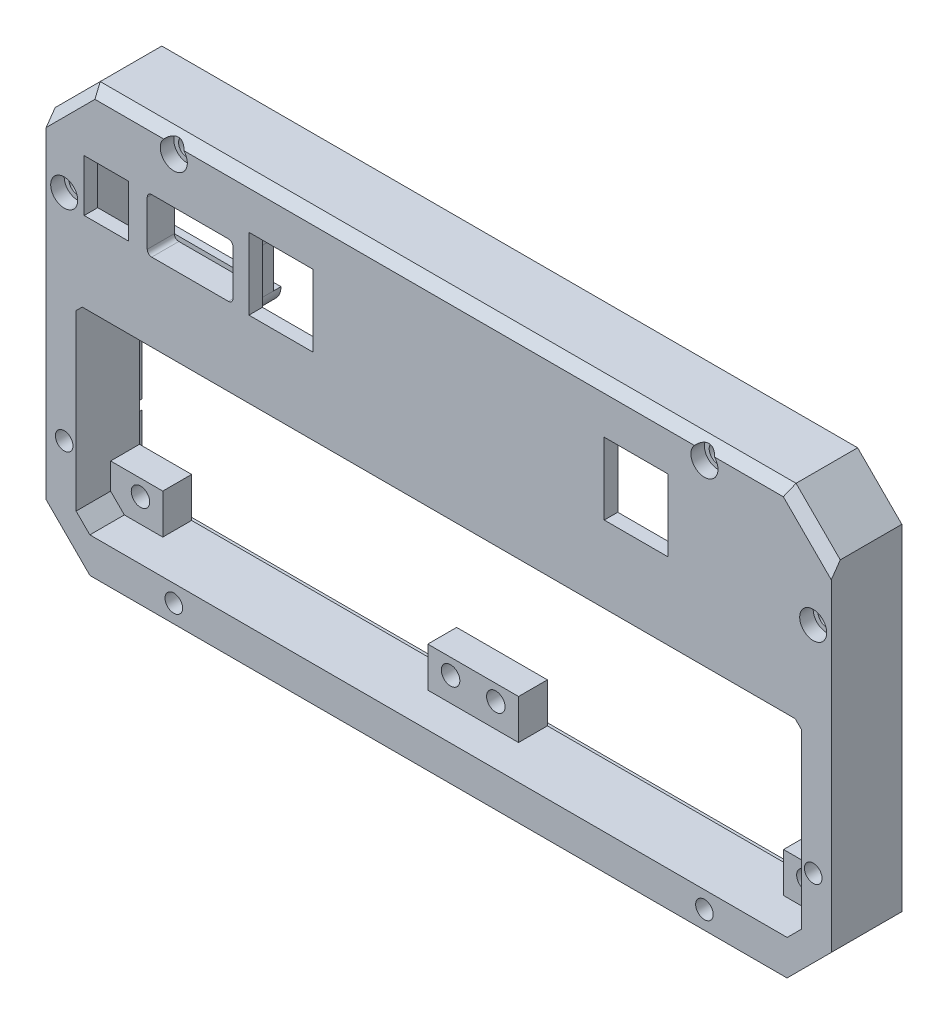
from build123d import *

# Parameters (mm, degrees)
EXTRUDE_1_DEPTH     = 15.65
SKETCH_4_W          = 9.8
SKETCH_4_H          = 11.5
SKETCH_4_W_2        = 12.96
SKETCH_4_H_2        = 14.97
EXTRUDE_4_DEPTH     = 3
SKETCH_5_R          = 1.95
CUT_EXTRUDE_1_DEPTH = 173.299210828
SKETCH_6_R          = 3
CUT_EXTRUDE_2_DEPTH = 3
SKETCH_9_W          = 10
SKETCH_9_H          = 8.842122099
SKETCH_9_R          = 2.05
SKETCH_9_H_2        = 11.008838114
EXTRUDE_5_DEPTH     = 6.4
CUT_EXTRUDE_3_DEPTH = 3
EXTRUDE_6_DEPTH     = 3
EXTRUDE_7_DEPTH     = 1.65
CHAMFER_2_SIZE      = 2
CUT_EXTRUDE_4_DEPTH = 1.6
SKETCH_14_W         = 158.083526154
SKETCH_14_H         = 7.071067811
EXTRUDE_8_DEPTH     = 3
CUT_EXTRUDE_5_DEPTH = 7
EXTRUDE_START       = 4.65
SKETCH_16_W         = 10
SKETCH_16_H         = 11.008838114
SKETCH_16_H_2       = 8.842122099
EXTRUDE_9_DEPTH     = 4.65
SKETCH_18_W         = 12.96
SKETCH_18_H         = 14.97
EXTRUDE_10_DEPTH    = 3
SKETCH_19_W         = 14.168486711
SKETCH_19_H         = 15.912581757
SKETCH_19_W_2       = 12.168486711
SKETCH_19_H_2       = 13.912581757
SKETCH_19_H_3       = 15.912581758
SKETCH_19_H_4       = 13.912581758
CUT_EXTRUDE_6_DEPTH = 173.052660694


with BuildPart() as part:
    # 草图1 → 凸台-拉伸1 (new body)
    with BuildSketch(Plane.XY):
        Polygon((-134.597401901, 96.434595611), (-134.597401901, 22.128293189), (-124.890175211, 12.421066499), (29.682675464, 12.421066499), (39.486124253, 22.224515288), (39.486124253, 96.618517711), (29.682675464, 106.421966499), (-124.610031013, 106.421966499), align=None)
        Polygon((-125.038101901, 94.680187113), (-121.296322514, 98.421966499), (26.368966965, 98.421966499), (29.452624253, 95.338309212), (31.486124253, 93.304809212), (31.486124253, 63.120887113), (32.844361176, 61.762650189), (32.844361176, 23.360926804), (29.704500871, 20.221066499), (-124.912000618, 20.221066499), (-127.955638824, 23.264704705), (-127.955638824, 61.762650189), (-126.597401901, 63.120887113), (-126.597401901, 93.120887113), align=None, mode=Mode.SUBTRACT)
    extrude(amount=EXTRUDE_1_DEPTH)

    # 草图5 → 切除-拉伸1 (cut, through all)
    with BuildSketch(Plane.XY.offset(15.65)):
        with Locations((-106.296322514, 102.421966499)):
            Circle(SKETCH_5_R)
        with Locations((11.368966965, 102.421966499)):
            Circle(SKETCH_5_R)
        with Locations((35.486124253, 83.120887113)):
            Circle(SKETCH_5_R)
        with Locations((35.486124253, 35.442001688)):
            Circle(SKETCH_5_R)
        with Locations((11.368966965, 16.421066499)):
            Circle(SKETCH_5_R)
        with Locations((-106.296322514, 16.421066499)):
            Circle(SKETCH_5_R)
        with Locations((-130.597401901, 35.442001688)):
            Circle(SKETCH_5_R)
        with Locations((-130.597401901, 83.120887113)):
            Circle(SKETCH_5_R)
    extrude(amount=-CUT_EXTRUDE_1_DEPTH, mode=Mode.SUBTRACT)

    # 草图6 → 切除-拉伸2 (cut)
    with BuildSketch(Plane.XY.offset(15.65)):
        with Locations((-130.597401901, 83.120887113)):
            Circle(SKETCH_6_R)
        with Locations((-106.296322514, 102.421966499)):
            Circle(SKETCH_6_R)
        with Locations((11.368966965, 102.421966499)):
            Circle(SKETCH_6_R)
        with Locations((35.486124253, 83.120887113)):
            Circle(SKETCH_6_R)
    extrude(amount=-CUT_EXTRUDE_2_DEPTH, mode=Mode.SUBTRACT)

    # 草图9 → 凸台-拉伸5 (add)
    # profile 1 of 7: a face of its own
    with BuildSketch(Plane.XY.offset(1.6)):
        with Locations((-109.379401901, 94.00090545)):
            Rectangle(SKETCH_9_W, SKETCH_9_H)
        with Locations(Location((-109.277479202, 93.020847168, 0), (0, 0, 180))):
            Circle(SKETCH_9_R, mode=Mode.SUBTRACT)
    # profile 2 of 7: a face of its own
    with BuildSketch(Plane.XY.offset(1.6)):
        Polygon((-47.635101901, 29.063188599), (-47.502375747, 29.063188599), (-37.502375747, 29.063188599), (-37.502375747, 20.221066499), (-47.635101901, 20.221066499), (-57.635101901, 20.221066499), (-57.635101901, 29.063188599), align=None)
        with Locations(Location((-52.57429681, 25.579954761, 0), (0, 0, 180))):
            Circle(SKETCH_9_R, mode=Mode.SUBTRACT)
        with Locations(Location((-42.540505261, 25.563037191, 0), (0, 0, 180))):
            Circle(SKETCH_9_R, mode=Mode.SUBTRACT)
    # profile 3 of 7: a face of its own
    with BuildSketch(Plane.XY.offset(1.6)):
        with Locations((-30.488175747, 94.00090545)):
            Rectangle(SKETCH_9_W, SKETCH_9_H)
        with Locations(Location((-30.485135247, 93.068897898, 0), (0, 0, 180))):
            Circle(SKETCH_9_R, mode=Mode.SUBTRACT)
    # profile 4 of 7: a face of its own
    with BuildSketch(Plane.XY.offset(1.6)):
        Polygon((-126.393601901, 29.063188599), (-116.393601901, 29.063188599), (-116.393601901, 20.221066499), (-124.912000618, 20.221066499), (-127.955638824, 23.264704705), (-127.955638824, 29.063188599), align=None)
        with Locations(Location((-121.332849216, 25.514986462, 0), (0, 0, 180))):
            Circle(SKETCH_9_R, mode=Mode.SUBTRACT)
    # profile 5 of 7: a face of its own
    with BuildSketch(Plane.XY.offset(1.6)):
        Polygon((21.256124253, 20.221066499), (21.256124253, 29.063188599), (31.256124253, 29.063188599), (32.844361176, 29.063188599), (32.844361176, 23.360926804), (29.704500871, 20.221066499), align=None)
        with Locations(Location((26.218047145, 25.62800549, 0), (0, 0, 180))):
            Circle(SKETCH_9_R, mode=Mode.SUBTRACT)
    # profile 6 of 7: a face of its own
    with BuildSketch(Plane.XY.offset(1.6)):
        with Locations((19.452353698, 92.917547442)):
            Rectangle(SKETCH_9_W, SKETCH_9_H_2)
        with Locations(Location((19.374110595, 91.489091443, 0), (0, 0, 180))):
            Circle(SKETCH_9_R, mode=Mode.SUBTRACT)
    # profile 7 of 7: a face of its own
    with BuildSketch(Plane.XY.offset(1.6)):
        with Locations((-59.438793215, 92.917547442)):
            Rectangle(SKETCH_9_W, SKETCH_9_H_2)
        with Locations(Location((-59.41823336, 91.441040714, 0), (0, 0, 180))):
            Circle(SKETCH_9_R, mode=Mode.SUBTRACT)
    extrude(amount=EXTRUDE_5_DEPTH)



with BuildPart() as body_2:
    # 草图4 → 凸台-拉伸4 (new body)
    with BuildSketch(Plane.XY.offset(15.65)):
        Polygon((-126.597401901, 70.191954924), (31.286124253, 70.191954924), (31.486124253, 70.191954924), (31.486124253, 93.304809212), (26.368966965, 98.421966499), (-121.296322514, 98.421966499), (-126.597401901, 93.120887113), align=None)
        with Locations((-121.266601901, 86.6720444)):
            Rectangle(SKETCH_4_W, SKETCH_4_H, mode=Mode.SUBTRACT)
        with Locations((-82.658601901, 88.1620444)):
            Rectangle(SKETCH_4_W_2, SKETCH_4_H_2, mode=Mode.SUBTRACT)
        with Locations((-3.767375747, 88.258266499)):
            Rectangle(SKETCH_4_W_2, SKETCH_4_H_2, mode=Mode.SUBTRACT)
    extrude(amount=-EXTRUDE_4_DEPTH)

    # 草图10 → 切除-拉伸3 (cut)
    with BuildSketch(Plane.XY.offset(15.65)):
        with BuildLine():
            Line((-111.186356688, 92.4220444), (-94.186356688, 92.4220444))
            ThreePointArc((-94.186356688, 92.4220444), (-93.479249906, 92.129151181), (-93.186356688, 91.4220444))
            Line((-93.186356688, 91.4220444), (-93.186356688, 81.4220444))
            ThreePointArc((-93.186356688, 81.4220444), (-93.479249906, 80.714937619), (-94.186356688, 80.4220444))
            Line((-94.186356688, 80.4220444), (-111.186356688, 80.4220444))
            ThreePointArc((-111.186356688, 80.4220444), (-111.893463469, 80.714937619), (-112.186356688, 81.4220444))
            Line((-112.186356688, 81.4220444), (-112.186356688, 91.4220444))
            ThreePointArc((-112.186356688, 91.4220444), (-111.893463469, 92.129151181), (-111.186356688, 92.4220444))
        make_face()
    extrude(amount=-CUT_EXTRUDE_3_DEPTH, mode=Mode.SUBTRACT)


with BuildPart() as part_1:
    add(part.part)

    add(body_2.part)  # 凸台-拉伸6 merges body 2
    # 草图11 → 凸台-拉伸6 (add)
    with BuildSketch(Plane(origin=(0, 0, 12.65), x_dir=(-1, 0, 0), z_dir=(0, 0, -1))):
        with BuildLine():
            Line((115.186356688, 91.4220444), (115.186356688, 81.4220444))
            ThreePointArc((115.186356688, 81.4220444), (114.014783812, 78.593617275), (111.186356688, 77.4220444))
            Line((111.186356688, 77.4220444), (94.186356688, 77.4220444))
            ThreePointArc((94.186356688, 77.4220444), (91.357929563, 78.593617275), (90.186356688, 81.4220444))
            Line((90.186356688, 81.4220444), (90.186356688, 91.4220444))
            ThreePointArc((90.186356688, 91.4220444), (91.357929563, 94.250471525), (94.186356688, 95.4220444))
            Line((94.186356688, 95.4220444), (111.186356688, 95.4220444))
            ThreePointArc((111.186356688, 95.4220444), (114.014783812, 94.250471525), (115.186356688, 91.4220444))
        make_face()
        with BuildLine():
            Line((112.186356688, 91.4220444), (112.186356688, 81.4220444))
            ThreePointArc((112.186356688, 81.4220444), (111.893463469, 80.714937619), (111.186356688, 80.4220444))
            Line((111.186356688, 80.4220444), (94.186356688, 80.4220444))
            ThreePointArc((94.186356688, 80.4220444), (93.479249906, 80.714937619), (93.186356688, 81.4220444))
            Line((93.186356688, 81.4220444), (93.186356688, 91.4220444))
            ThreePointArc((93.186356688, 91.4220444), (93.479249906, 92.129151181), (94.186356688, 92.4220444))
            Line((94.186356688, 92.4220444), (111.186356688, 92.4220444))
            ThreePointArc((111.186356688, 92.4220444), (111.893463469, 92.129151181), (112.186356688, 91.4220444))
        make_face(mode=Mode.SUBTRACT)
    extrude(amount=EXTRUDE_6_DEPTH)

    # 草图12 → 凸台-拉伸7 (add)
    with BuildSketch(Plane(origin=(0, 0, 9.65), x_dir=(-1, 0, 0), z_dir=(0, 0, -1))):
        with BuildLine():
            Line((90.186356688, 81.4220444), (115.186356688, 81.4220444))
            ThreePointArc((115.186356688, 81.4220444), (114.014783812, 78.593617275), (111.186356688, 77.4220444))
            Line((111.186356688, 77.4220444), (94.186356688, 77.4220444))
            ThreePointArc((94.186356688, 77.4220444), (91.357929563, 78.593617275), (90.186356688, 81.4220444))
        make_face()
        with BuildLine():
            Line((90.186356688, 91.4220444), (115.186356688, 91.4220444))
            ThreePointArc((115.186356688, 91.4220444), (114.014783812, 94.250471525), (111.186356688, 95.4220444))
            Line((111.186356688, 95.4220444), (94.186356688, 95.4220444))
            ThreePointArc((94.186356688, 95.4220444), (91.357929563, 94.250471525), (90.186356688, 91.4220444))
        make_face()
    extrude(amount=EXTRUDE_7_DEPTH)

    # 倒角2
    # the kernel refuses this chamfer: 2 mm, written as the material it takes off along each edge
    with BuildSketch(Plane(origin=(-120.973122053, 110.058875459, 15.65), x_dir=(0.7068394360706736, -0.7068394360706736, 0.027495876610586428), z_dir=(-0.7071067811865476, -0.7071067811865476, 0))) as chamfer_2_piece_1:
        Polygon((CHAMFER_2_SIZE * 0.999621916911, -CHAMFER_2_SIZE * 0.0274958766106), (-CHAMFER_2_SIZE * 0.0274958766106, -CHAMFER_2_SIZE * 0.999621916911), (0, 0), align=None)
    extrude(amount=24.411007314, mode=Mode.SUBTRACT)
    with BuildSketch(Plane(origin=(43.123033212, 92.981608751, 15.65), x_dir=(-0.7068394360706716, -0.7068394360706755, 0.027495876610586494), z_dir=(-0.7071067811865495, 0.7071067811865456, 0))) as chamfer_2_piece_2:
        Polygon((CHAMFER_2_SIZE * 0.999621916911, -CHAMFER_2_SIZE * 0.0274958766106), (-CHAMFER_2_SIZE * 0.0274958766106, -CHAMFER_2_SIZE * 0.999621916911), (0, 0), align=None)
    extrude(amount=24.150902187, mode=Mode.SUBTRACT)
    with BuildSketch(Plane(origin=(34.82604144, 106.421966499, 15.65), x_dir=(0, -0.9996219169112968, 0.027495876610586414), z_dir=(-1, 0, 0))) as chamfer_2_piece_3:
        Polygon((CHAMFER_2_SIZE * 0.999621916911, -CHAMFER_2_SIZE * 0.0274958766106), (-CHAMFER_2_SIZE * 0.0274958766106, -CHAMFER_2_SIZE * 0.999621916911), (0, 0), align=None)
    extrude(amount=164.579438429, mode=Mode.SUBTRACT)

    # 草图13 → 切除-拉伸4 (cut)
    with BuildSketch(Plane(origin=(0, 0, 0), x_dir=(-1, 0, 0), z_dir=(0, 0, -1))):
        Polygon((-33.844361176, 22.946713242), (-33.844361176, 62.176863751), (-32.486124253, 63.535100675), (-32.486124253, 93.719022774), (-26.783180527, 99.421966499), (121.710536076, 99.421966499), (127.597401901, 93.535100675), (127.597401901, 63.535100675), (128.955638824, 62.176863751), (128.955638824, 22.850491143), (125.326214181, 19.221066499), (-30.118714433, 19.221066499), align=None)
    extrude(amount=-CUT_EXTRUDE_4_DEPTH, mode=Mode.SUBTRACT)

    # 草图14 → 凸台-拉伸8 (add)
    with BuildSketch(Plane.XY.offset(15.65)):
        with Locations((-47.555638824, 66.656421018)):
            Rectangle(SKETCH_14_W, SKETCH_14_H)
    extrude(amount=-EXTRUDE_8_DEPTH)

    # 草图15 → 切除-拉伸5 (cut)
    with BuildSketch(Plane(origin=(0, 0, 1.6), x_dir=(-1, 0, 0), z_dir=(0, 0, -1))):
        Polygon((54.438793215, 90.413128385), (54.438793215, 87.413128385), (57.438793215, 87.413128385), align=None)
    extrude(amount=-CUT_EXTRUDE_5_DEPTH, mode=Mode.SUBTRACT)

    # 草图16 → 凸台-拉伸9 (add)
    with BuildSketch(Plane.XY.offset(8).offset(EXTRUDE_START)):
        with Locations((19.452353698, 92.917547442)):
            Rectangle(SKETCH_16_W, SKETCH_16_H)
        Polygon((-54.438793215, 98.421966499), (-64.438793215, 98.421966499), (-64.438793215, 87.413128385), (-57.438793215, 87.413128385), (-54.438793215, 90.413128385), align=None)
        with Locations((-30.488175747, 94.00090545)):
            Rectangle(SKETCH_16_W, SKETCH_16_H_2)
        with BuildLine():
            Line((-104.379401901, 98.421966499), (-104.379401901, 95.4220444))
            Line((-104.379401901, 95.4220444), (-111.186356688, 95.4220444))
            ThreePointArc((-111.186356688, 95.4220444), (-112.970035377, 95.002336334), (-114.379401901, 93.831289566))
            Line((-114.379401901, 93.831289566), (-114.379401901, 98.421966499))
            Line((-114.379401901, 98.421966499), (-104.379401901, 98.421966499))
        make_face()
    extrude(amount=-EXTRUDE_9_DEPTH)

    # 草图18 → 凸台-拉伸10 (add)
    with BuildSketch(Plane.XY.offset(15.65)):
        with Locations((-3.767375747, 88.258266499)):
            Rectangle(SKETCH_18_W, SKETCH_18_H)
        with Locations((-82.658601901, 88.1620444)):
            Rectangle(SKETCH_18_W, SKETCH_18_H)
    extrude(amount=-EXTRUDE_10_DEPTH)

    # 草图19 → 切除-拉伸6 (cut, through all)
    # profile 1 of 4: a face of its own
    with BuildSketch(Plane(origin=(0, 0, 12.65), x_dir=(-1, 0, 0), z_dir=(0, 0, -1))):
        with Locations((82.55973398, 88.003552687)):
            Rectangle(SKETCH_19_W, SKETCH_19_H)
        with Locations((82.55973398, 88.003552687)):
            Rectangle(SKETCH_19_W_2, SKETCH_19_H_2, mode=Mode.SUBTRACT)
    # profile 2 of 4: a face of its own
    with BuildSketch(Plane(origin=(0, 0, 12.65), x_dir=(-1, 0, 0), z_dir=(0, 0, -1))):
        with Locations((82.55973398, 88.003552687)):
            Rectangle(SKETCH_19_W_2, SKETCH_19_H_2)
    # profile 3 of 4: a face of its own
    with BuildSketch(Plane(origin=(0, 0, 12.65), x_dir=(-1, 0, 0), z_dir=(0, 0, -1))):
        with Locations((3.767390026, 88.051603416)):
            Rectangle(SKETCH_19_W, SKETCH_19_H_3)
        with Locations((3.767390026, 88.051603416)):
            Rectangle(SKETCH_19_W_2, SKETCH_19_H_4, mode=Mode.SUBTRACT)
    # profile 4 of 4: a face of its own
    with BuildSketch(Plane(origin=(0, 0, 12.65), x_dir=(-1, 0, 0), z_dir=(0, 0, -1))):
        with Locations((3.767390026, 88.051603416)):
            Rectangle(SKETCH_19_W_2, SKETCH_19_H_4)
    extrude(amount=-CUT_EXTRUDE_6_DEPTH, mode=Mode.SUBTRACT)


solid = part_1.part
